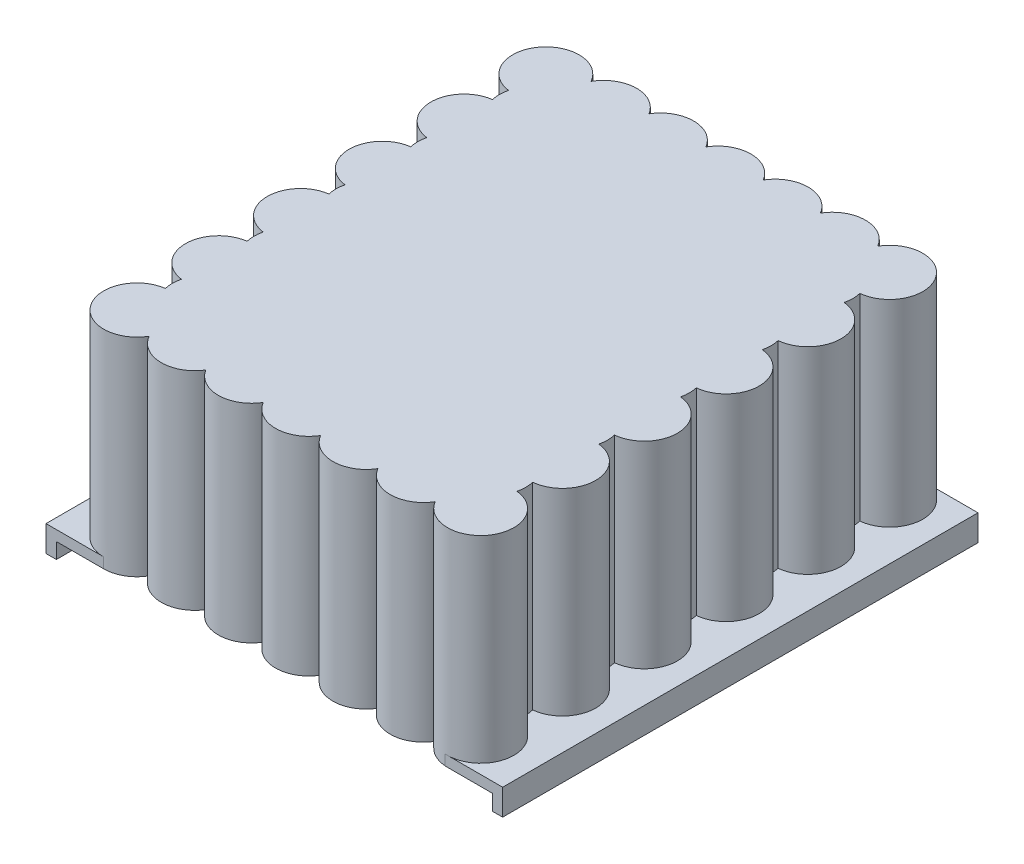
from build123d import *

# Parameters (mm, degrees)
SKETCH3_W           = 266.7
SKETCH3_H           = 304.8
BOSS_EXTRUDE1_DEPTH = 127
SKETCH2_R           = 14
CUT_EXTRUDE1_DEPTH  = 101.6
SKETCH5_W           = 266.7
SKETCH5_H           = 304.8
CUT_EXTRUDE2_DEPTH  = 240.858842452
BOSS_EXTRUDE2_DEPTH = 6.35
SKETCH7_W           = 88.9
SKETCH7_H           = 63.5
BOSS_EXTRUDE4_DEPTH = 6.35
SKETCH10_W          = 6.35
SKETCH10_H          = 290.83
BOSS_EXTRUDE5_DEPTH = 9.525


with BuildPart() as part:
    # Sketch3 → Boss-Extrude1 (new body)
    with BuildSketch(Plane(origin=(0, 0, 0), x_dir=(1, 0, 0), z_dir=(0, 1, 0))):
        with Locations((1.030211855, 0.391436162)):
            Rectangle(SKETCH3_W, SKETCH3_H)
    extrude(amount=BOSS_EXTRUDE1_DEPTH)

    # Sketch2 → Cut-Extrude1 (cut)
    with BuildSketch(Plane(origin=(0, 0, 0), x_dir=(1, 0, 0), z_dir=(0, 1, 0))):
        with Locations((-104.384517455, 125.341266146)):
            Circle(SKETCH2_R)
        with Locations((-69.384517455, 125.341266146)):
            Circle(SKETCH2_R)
        with Locations((-34.384517455, 125.341266146)):
            Circle(SKETCH2_R)
        with Locations((0.615482545, 125.341266146)):
            Circle(SKETCH2_R)
        with Locations((35.615482545, 125.341266146)):
            Circle(SKETCH2_R)
        with Locations((70.615482545, 125.341266146)):
            Circle(SKETCH2_R)
        with Locations((105.615482545, 125.341266146)):
            Circle(SKETCH2_R)
        with Locations((-69.384517455, 75.341266146)):
            Circle(SKETCH2_R)
        with Locations((-34.384517455, 75.341266146)):
            Circle(SKETCH2_R)
        with Locations((0.615482545, 75.341266146)):
            Circle(SKETCH2_R)
        with Locations((35.615482545, 75.341266146)):
            Circle(SKETCH2_R)
        with Locations((70.615482545, 75.341266146)):
            Circle(SKETCH2_R)
        with Locations((105.615482545, 75.341266146)):
            Circle(SKETCH2_R)
        with Locations((-69.384517455, 25.341266146)):
            Circle(SKETCH2_R)
        with Locations((-34.384517455, 25.341266146)):
            Circle(SKETCH2_R)
        with Locations((0.615482545, 25.341266146)):
            Circle(SKETCH2_R)
        with Locations((35.615482545, 25.341266146)):
            Circle(SKETCH2_R)
        with Locations((70.615482545, 25.341266146)):
            Circle(SKETCH2_R)
        with Locations((105.615482545, 25.341266146)):
            Circle(SKETCH2_R)
        with Locations((-69.384517455, -24.658733854)):
            Circle(SKETCH2_R)
        with Locations((-34.384517455, -24.658733854)):
            Circle(SKETCH2_R)
        with Locations((0.615482545, -24.658733854)):
            Circle(SKETCH2_R)
        with Locations((35.615482545, -24.658733854)):
            Circle(SKETCH2_R)
        with Locations((70.615482545, -24.658733854)):
            Circle(SKETCH2_R)
        with Locations((105.615482545, -24.658733854)):
            Circle(SKETCH2_R)
        with Locations((-69.384517455, -74.658733854)):
            Circle(SKETCH2_R)
        with Locations((-34.384517455, -74.658733854)):
            Circle(SKETCH2_R)
        with Locations((0.615482545, -74.658733854)):
            Circle(SKETCH2_R)
        with Locations((35.615482545, -74.658733854)):
            Circle(SKETCH2_R)
        with Locations((70.615482545, -74.658733854)):
            Circle(SKETCH2_R)
        with Locations((105.615482545, -74.658733854)):
            Circle(SKETCH2_R)
        with Locations((-69.384517455, -124.658733854)):
            Circle(SKETCH2_R)
        with Locations((-34.384517455, -124.658733854)):
            Circle(SKETCH2_R)
        with Locations((0.615482545, -124.658733854)):
            Circle(SKETCH2_R)
        with Locations((35.615482545, -124.658733854)):
            Circle(SKETCH2_R)
        with Locations((70.615482545, -124.658733854)):
            Circle(SKETCH2_R)
        with Locations((105.615482545, -124.658733854)):
            Circle(SKETCH2_R)
        with Locations((-104.384517455, 75.341266146)):
            Circle(SKETCH2_R)
        with Locations((-104.384517455, 25.341266146)):
            Circle(SKETCH2_R)
        with Locations((-104.384517455, -24.658733854)):
            Circle(SKETCH2_R)
        with Locations((-104.384517455, -74.658733854)):
            Circle(SKETCH2_R)
        with Locations((-104.384517455, -124.658733854)):
            Circle(SKETCH2_R)
        with Locations((-87.384517455, 100.341266146)):
            Circle(SKETCH2_R)
        with Locations((-52.384517455, 100.341266146)):
            Circle(SKETCH2_R)
        with Locations((-17.384517455, 100.341266146)):
            Circle(SKETCH2_R)
        with Locations((17.615482545, 100.341266146)):
            Circle(SKETCH2_R)
        with Locations((52.615482545, 100.341266146)):
            Circle(SKETCH2_R)
        with Locations((87.615482545, 100.341266146)):
            Circle(SKETCH2_R)
        with Locations((-52.384517455, 50.341266146)):
            Circle(SKETCH2_R)
        with Locations((-17.384517455, 50.341266146)):
            Circle(SKETCH2_R)
        with Locations((17.615482545, 50.341266146)):
            Circle(SKETCH2_R)
        with Locations((52.615482545, 50.341266146)):
            Circle(SKETCH2_R)
        with Locations((87.615482545, 50.341266146)):
            Circle(SKETCH2_R)
        with Locations((-52.384517455, 0.341266146)):
            Circle(SKETCH2_R)
        with Locations((-17.384517455, 0.341266146)):
            Circle(SKETCH2_R)
        with Locations((17.615482545, 0.341266146)):
            Circle(SKETCH2_R)
        with Locations((52.615482545, 0.341266146)):
            Circle(SKETCH2_R)
        with Locations((87.615482545, 0.341266146)):
            Circle(SKETCH2_R)
        with Locations((-52.384517455, -49.658733854)):
            Circle(SKETCH2_R)
        with Locations((-17.384517455, -49.658733854)):
            Circle(SKETCH2_R)
        with Locations((17.615482545, -49.658733854)):
            Circle(SKETCH2_R)
        with Locations((52.615482545, -49.658733854)):
            Circle(SKETCH2_R)
        with Locations((87.615482545, -49.658733854)):
            Circle(SKETCH2_R)
        with Locations((-52.384517455, -99.658733854)):
            Circle(SKETCH2_R)
        with Locations((-17.384517455, -99.658733854)):
            Circle(SKETCH2_R)
        with Locations((17.615482545, -99.658733854)):
            Circle(SKETCH2_R)
        with Locations((52.615482545, -99.658733854)):
            Circle(SKETCH2_R)
        with Locations((87.615482545, -99.658733854)):
            Circle(SKETCH2_R)
        with Locations((-87.384517455, 50.341266146)):
            Circle(SKETCH2_R)
        with Locations((-87.384517455, 0.341266146)):
            Circle(SKETCH2_R)
        with Locations((-87.384517455, -49.658733854)):
            Circle(SKETCH2_R)
        with Locations((-87.384517455, -99.658733854)):
            Circle(SKETCH2_R)
    extrude(amount=CUT_EXTRUDE1_DEPTH, mode=Mode.SUBTRACT)

    # Sketch5 → Cut-Extrude2 (cut, through all)
    with BuildSketch(Plane.XZ):
        with Locations((1.030211855, -0.391436162)):
            Rectangle(SKETCH5_W, SKETCH5_H)
        with BuildLine():
            ThreePointArc((-86.775223532, 134.798515287), (-121.25188109, 135.98986107), (-107.113753094, 104.522853619))
            ThreePointArc((-107.113753094, 104.522853619), (-107.704508629, 99.639794762), (-107.104651694, 94.757845606))
            ThreePointArc((-107.104651694, 94.757845606), (-124.704516936, 74.625326024), (-107.113753094, 54.484853619))
            ThreePointArc((-107.113753094, 54.484853619), (-107.704508629, 49.601794762), (-107.104651694, 44.719845606))
            ThreePointArc((-107.104651694, 44.719845606), (-124.704516936, 24.587326024), (-107.113753094, 4.446853619))
            ThreePointArc((-107.113753094, 4.446853619), (-107.704508629, -0.436205238), (-107.104651694, -5.318154394))
            ThreePointArc((-107.104651694, -5.318154394), (-124.704516936, -25.450673976), (-107.113753094, -45.591146381))
            ThreePointArc((-107.113753094, -45.591146381), (-107.704508629, -50.474205238), (-107.104651694, -55.356154394))
            ThreePointArc((-107.104651694, -55.356154394), (-124.704516936, -75.488673976), (-107.113753094, -95.629146381))
            ThreePointArc((-107.113753094, -95.629146381), (-107.704508629, -100.512205238), (-107.104651694, -105.394154394))
            ThreePointArc((-107.104651694, -105.394154394), (-121.162990751, -136.993605954), (-86.614743522, -135.387103725))
            ThreePointArc((-86.614743522, -135.387103725), (-69.332292243, -145.712785219), (-51.719624887, -135.961027984))
            ThreePointArc((-51.719624887, -135.961027984), (-34.195273648, -145.851087344), (-16.754517455, -135.814345646))
            ThreePointArc((-16.754517455, -135.814345646), (0.771482545, -145.851266146), (18.297482545, -135.814345646))
            ThreePointArc((18.297482545, -135.814345646), (35.823482545, -145.851266146), (53.349482545, -135.814345646))
            ThreePointArc((53.349482545, -135.814345646), (70.875482545, -145.851266146), (88.401482545, -135.814345646))
            ThreePointArc((88.401482545, -135.814345646), (123.036065237, -136.4947874), (107.948012416, -105.311971919))
            ThreePointArc((107.948012416, -105.311971919), (108.527626689, -100.51235477), (107.957030963, -95.711657112))
            ThreePointArc((107.957030963, -95.711657112), (126.247482039, -75.488734313), (107.948012416, -55.273971919))
            ThreePointArc((107.948012416, -55.273971919), (108.527626689, -50.47435477), (107.957030963, -45.673657112))
            ThreePointArc((107.957030963, -45.673657112), (126.247482039, -25.450734313), (107.948012416, -5.235971919))
            ThreePointArc((107.948012416, -5.235971919), (108.527626689, -0.43635477), (107.957030963, 4.364342888))
            ThreePointArc((107.957030963, 4.364342888), (126.247482039, 24.587265687), (107.948012416, 44.802028081))
            ThreePointArc((107.948012416, 44.802028081), (108.527626689, 49.60164523), (107.957030963, 54.402342888))
            ThreePointArc((107.957030963, 54.402342888), (126.247482039, 74.625265687), (107.948012416, 94.840028081))
            ThreePointArc((107.948012416, 94.840028081), (108.527626689, 99.63964523), (107.957030963, 104.440342888))
            ThreePointArc((107.957030963, 104.440342888), (123.03361969, 135.626070448), (88.401482545, 134.941813353))
            ThreePointArc((88.401482545, 134.941813353), (70.875482545, 144.978733854), (53.349482545, 134.941813353))
            ThreePointArc((53.349482545, 134.941813353), (35.823482545, 144.978733854), (18.297482545, 134.941813353))
            ThreePointArc((18.297482545, 134.941813353), (0.771482545, 144.978733854), (-16.754517455, 134.941813353))
            ThreePointArc((-16.754517455, 134.941813353), (-34.037988271, 144.97728645), (-51.556074361, 135.357216624))
            ThreePointArc((-51.556074361, 135.357216624), (-69.32494992, 145.119804961), (-86.775223532, 134.798515287))
        make_face(mode=Mode.SUBTRACT)
    extrude(amount=-CUT_EXTRUDE2_DEPTH, mode=Mode.SUBTRACT)

    # Sketch6 → Boss-Extrude2 (add)
    with BuildSketch(Plane.XZ):
        with BuildLine():
            Line((-104.384517455, 144.978733854), (-139.7, 144.978733854))
            Line((-139.7, 144.978733854), (-139.7, -145.851266146))
            Line((-139.7, -145.851266146), (-104.384517455, -145.851266146))
            ThreePointArc((-104.384517455, -145.851266146), (-124.658743838, -126.894403923), (-107.104651694, -105.394154394))
            ThreePointArc((-107.104651694, -105.394154394), (-107.704508629, -100.512205238), (-107.113753094, -95.629146381))
            ThreePointArc((-107.113753094, -95.629146381), (-124.704516936, -75.488673976), (-107.104651694, -55.356154394))
            ThreePointArc((-107.104651694, -55.356154394), (-107.704508629, -50.474205238), (-107.113753094, -45.591146381))
            ThreePointArc((-107.113753094, -45.591146381), (-124.704516936, -25.450673976), (-107.104651694, -5.318154394))
            ThreePointArc((-107.104651694, -5.318154394), (-107.704508629, -0.436205238), (-107.113753094, 4.446853619))
            ThreePointArc((-107.113753094, 4.446853619), (-124.704516936, 24.587326024), (-107.104651694, 44.719845606))
            ThreePointArc((-107.104651694, 44.719845606), (-107.704508629, 49.601794762), (-107.113753094, 54.484853619))
            ThreePointArc((-107.113753094, 54.484853619), (-124.704516936, 74.625326024), (-107.104651694, 94.757845606))
            ThreePointArc((-107.104651694, 94.757845606), (-107.704508629, 99.639794762), (-107.113753094, 104.522853619))
            ThreePointArc((-107.113753094, 104.522853619), (-124.658435261, 126.026453421), (-104.384517455, 144.978733854))
        make_face()
    boss_extrude2 = extrude(amount=-BOSS_EXTRUDE2_DEPTH)

    # Mirror2: Boss-Extrude2 across plane
    add(boss_extrude2.mirror(Plane(origin=(0, 0, 0), x_dir=(0, 0, 1), z_dir=(1, 0, 0))))

    # Sketch10 → Boss-Extrude5 (add)
    with BuildSketch(Plane.XZ):
        with Locations((-136.525, -0.436266146)):
            Rectangle(SKETCH10_W, SKETCH10_H)
    boss_extrude5 = extrude(amount=BOSS_EXTRUDE5_DEPTH)

    # Mirror3: Boss-Extrude5 across plane
    add(boss_extrude5.mirror(Plane(origin=(0, 0, 0), x_dir=(0, 0, 1), z_dir=(1, 0, 0))))


with BuildPart() as body_2:
    # Sketch7 → Boss-Extrude4 (new body)
    with BuildSketch(Plane(origin=(0, 0, -145.851266146), x_dir=(-1, 0, 0), z_dir=(0, 0, -1))):
        with Locations((0, 57.15)):
            Rectangle(SKETCH7_W, SKETCH7_H)
    extrude(amount=BOSS_EXTRUDE4_DEPTH)


solid = Compound([part.part, body_2.part])
